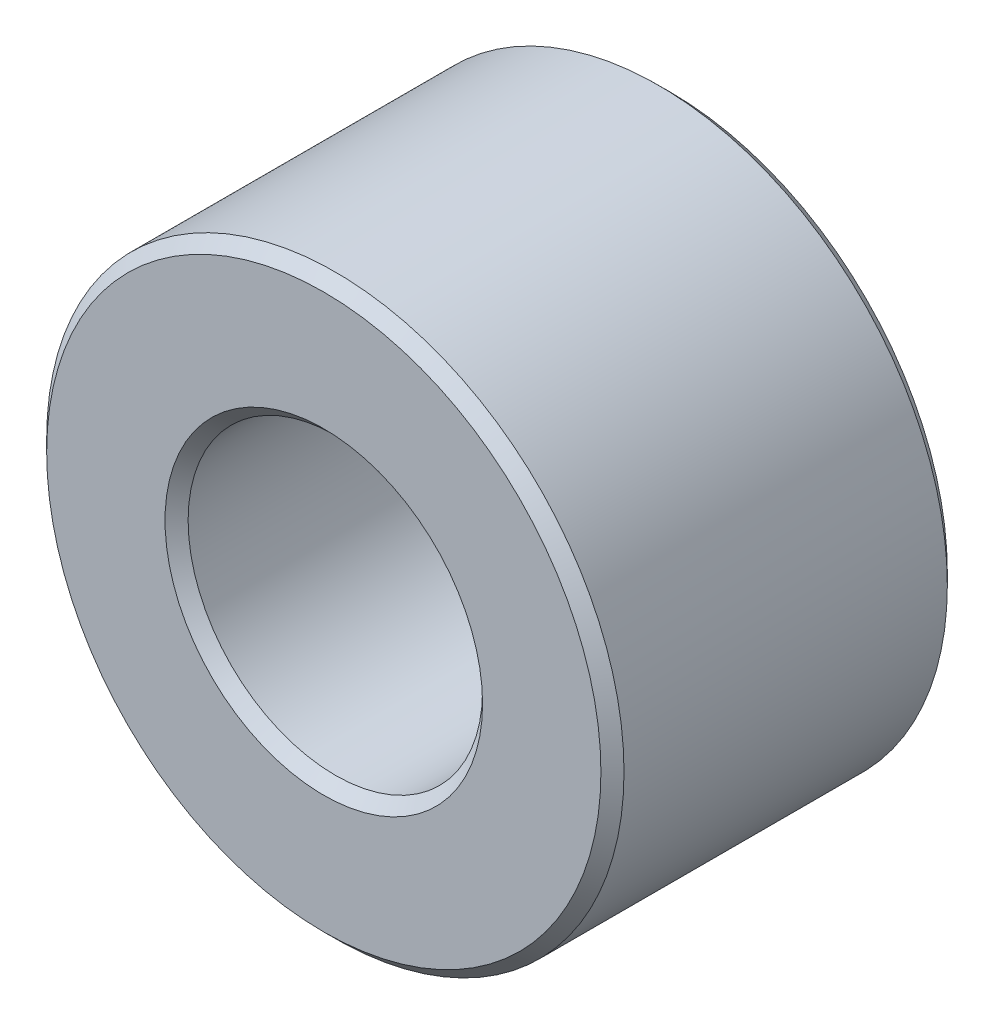
from build123d import *

# Parameters (mm, degrees)
SKETCH1_R           = 5
SKETCH1_R_2         = 2.55
BOSS_EXTRUDE1_DEPTH = 6
CHAMFER1_SIZE       = 0.2


with BuildPart() as part:
    # Sketch1 → Boss-Extrude1 (new body)
    with BuildSketch(Plane.XY):
        Circle(SKETCH1_R)
        Circle(SKETCH1_R_2, mode=Mode.SUBTRACT)
    extrude(amount=BOSS_EXTRUDE1_DEPTH)

    # Chamfer1
    chamfer1_edges = [part.edges().sort_by_distance(p)[0] for p in [
        (-5, 0, 0),
        (-2.55, 0, 0),
        (-2.55, 0, 6),
        (-5, 0, 6),
    ]]
    chamfer(chamfer1_edges, length=CHAMFER1_SIZE)


solid = part.part
